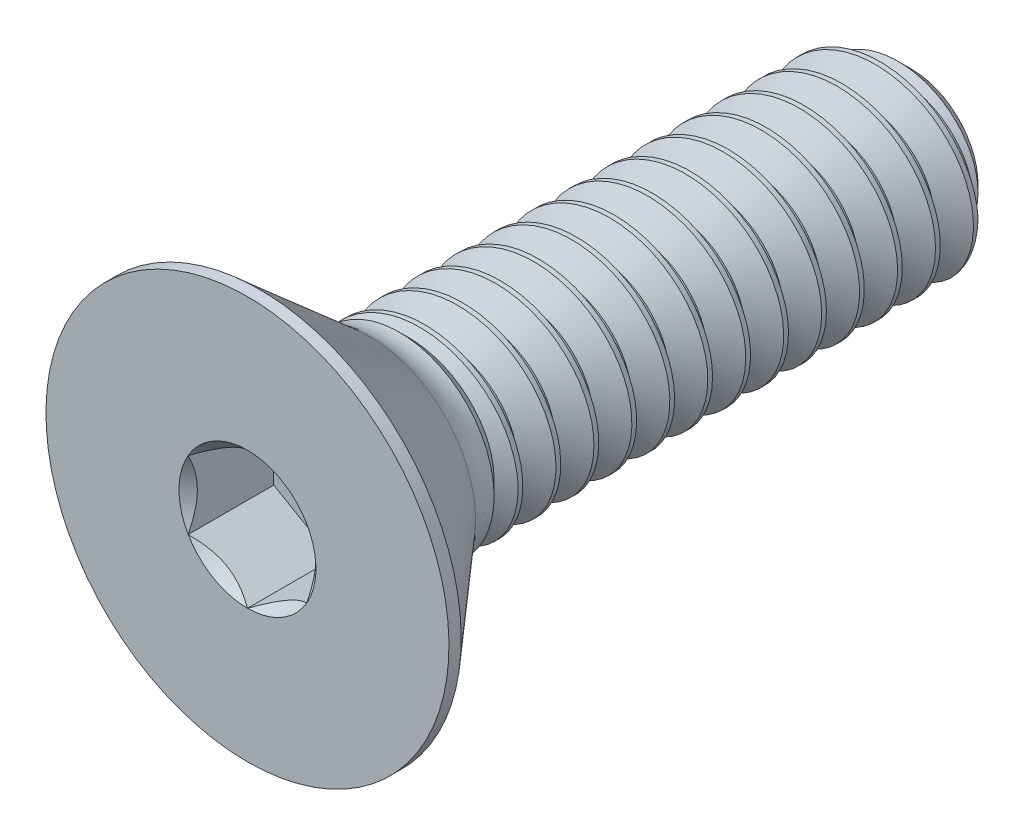
from build123d import *

# Parameters (mm, degrees)
SKETCH1_W          = 22.225
SKETCH1_H          = 3.175
CHAMFER1_SIZE      = 0.9525
CUT_SWEEP1_PITCH   = 1.27
CUT_EXTRUDE2_DEPTH = 2.86258


with BuildPart() as part:
    # Sketch1 → Revolve1 (revolve)
    with BuildSketch(Plane(origin=(0, 0, 0), x_dir=(0, 0, -1), z_dir=(1, 0, 0))):
        with Locations((11.1125, 1.5875)):
            Rectangle(SKETCH1_W, SKETCH1_H)
    revolve(axis=Axis((0, 0, -22.225), (0, 0, 1)))

    # Chamfer1
    chamfer1_edges = [part.edges().sort_by_distance(p)[0] for p in [
        (0, -3.175, -22.225),
    ]]
    chamfer(chamfer1_edges, length=CHAMFER1_SIZE)

    # Cut-Sweep1: arcs per turn and ends read off the stored shape
    # Cut-Sweep1: the profile of Sketch2 profile screwed along a right-hand helix through 19 turns, 8 arcs to a turn; built about Z, then put on its axis
    cut_sweep1_z = Axis((0, 0, 0), (0, 0, 1))
    cut_sweep1_corners = [(3.1753, 0, 0.000173205), (3.1753, 0, -1.111423205), (2.350110803, 0, -0.635), (2.350110803, 0, -0.47625)]
    with BuildLine(mode=Mode.PRIVATE) as cut_sweep1_profile:
        Line(cut_sweep1_corners[0], cut_sweep1_corners[1])
        Line(cut_sweep1_corners[1], cut_sweep1_corners[2])
        Line(cut_sweep1_corners[2], cut_sweep1_corners[3])
        Line(cut_sweep1_corners[3], cut_sweep1_corners[0])
    cut_sweep1_cap = Face(cut_sweep1_profile.wire())
    cut_sweep1_turn_angles = [0, 22.5, 45, 67.5, 90, 112.5, 135, 157.5, 180, 202.5, 225, 247.5, 270, 292.5, 315, 337.5, 360]
    cut_sweep1_turn_weights = [1, 0.9238795325112867, 1, 0.9238795325112867, 1, 0.9238795325112867, 1, 0.9238795325112867, 1, 0.9238795325112867, 1, 0.9238795325112867, 1, 0.9238795325112867, 1, 0.9238795325112867, 1]
    cut_sweep1_turn_rails = [Edge.make_bspline([Vector(p[0], p[1], 0).rotate(cut_sweep1_z, cut_sweep1_turn_angles[k]) / cut_sweep1_turn_weights[k] + Vector(0, 0, p[2] + CUT_SWEEP1_PITCH * cut_sweep1_turn_angles[k] / 360) for k in range(17)], [0, 0, 0, 1, 1, 2, 2, 3, 3, 4, 4, 5, 5, 6, 6, 7, 7, 8, 8, 8], 2, cut_sweep1_turn_weights) for p in cut_sweep1_corners]
    cut_sweep1_turn_sides = [Face.make_surface_from_curves(cut_sweep1_turn_rails[p[0]], cut_sweep1_turn_rails[p[1]]) for p in [(0, 1), (1, 2), (2, 3), (3, 0)]]
    cut_sweep1_turn = Solid(Shell([*cut_sweep1_turn_sides, cut_sweep1_cap, cut_sweep1_cap.rotate(cut_sweep1_z, 360).moved(Location((0, 0, CUT_SWEEP1_PITCH * 360 / 360)))]))
    cut_sweep1_each = [*[cut_sweep1_turn.moved(Location((0, 0, CUT_SWEEP1_PITCH * i))) for i in range(19)]]
    add(Plane(origin=(0, 0, -22.225), x_dir=(0, 1, 0), z_dir=(0, 0, 1)) * Compound([cut_sweep1_each[i] for i in range(0, 19, 2)]), mode=Mode.SUBTRACT)
    add(Plane(origin=(0, 0, -22.225), x_dir=(0, 1, 0), z_dir=(0, 0, 1)) * Compound([cut_sweep1_each[i] for i in range(1, 19, 2)]), mode=Mode.SUBTRACT)


with BuildPart() as body_2:
    # Sketch7 → Revolve2 (revolve)
    with BuildSketch(Plane(origin=(0, 0, 0), x_dir=(0, 0, -1), z_dir=(1, 0, 0)), mode=Mode.PRIVATE) as revolve2_sk:
        with BuildLine():
            Line((0, 6.7437), (0.40894, 6.7437))
            Line((0.40894, 6.7437), (4.0894, 3.544324933))
            ThreePointArc((4.0894, 3.544324933), (4.549909788, 3.270350399), (5.077204404, 3.175))
            Line((5.077204404, 3.175), (5.077204404, 0))
            Line((5.077204404, 0), (0, 0))
            Line((0, 0), (0, 6.7437))
        make_face()
    revolve(revolve2_sk.sketch.rotate(Axis((0, 0, 0), (0, 0, -1)), 180), axis=Axis((0, 0, 0), (0, 0, -1)))

    # Boss-Extrude1 cone 1 section (through the dimple's axis) → Boss-Extrude1 (revolve)
    with BuildSketch(Plane(origin=(0, 0, -5.077204404), x_dir=(0, -1, 0), z_dir=(1, 0, 0))):
        Polygon((0, 0), (3.175, 0), (0, 3.175), align=None)
    revolve(axis=Axis((0, 0, -5.077204404), (0, 0, -1)))

    # Combine1: union part
    add(part.part)

    # Sketch5 → Cut-Extrude2 (cut)
    with BuildSketch(Plane.XY):
        Polygon((1.984375, -1.14567944), (1.984375, 1.14567944), (0, 2.291358881), (-1.984375, 1.14567944), (-1.984375, -1.14567944), (0, -2.291358881), align=None)
    extrude(amount=-CUT_EXTRUDE2_DEPTH, mode=Mode.SUBTRACT)

    # Cut-Extrude3 cone 1 section (through the dimple's axis) → Cut-Extrude3 (revolve, cut)
    with BuildSketch(Plane(origin=(0, 0, 0), x_dir=(0, -1, 0), z_dir=(1, 0, 0))):
        Polygon((0, 0), (2.291358881, 0), (0, 2.291358881), align=None)
    revolve(axis=Axis((0, 0, 0), (0, 0, -1)), mode=Mode.SUBTRACT)


solid = body_2.part
